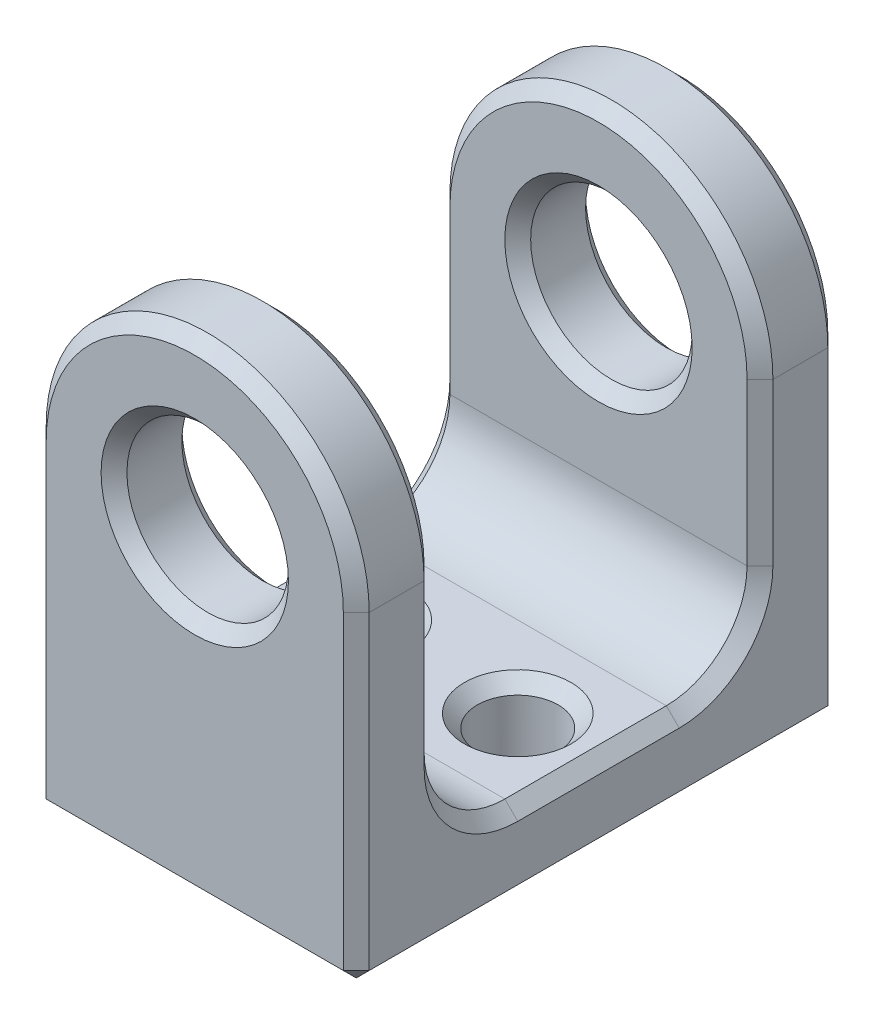
from build123d import *

# Parameters (mm, degrees)
SKETCH1_R                    = 3.175
BOSS_EXTRUDE1_DEPTH          = 9.525
CUT_EXTRUDE1_DEPTH           = 18.097898263
CUT_EXTRUDE1_DEPTH_BACK      = 18.097898263
SKETCH2_W                    = 12.7
SKETCH2_H                    = 15.875
F_1_8_0_125_DIAMETER_HOLE1_D = 3.175
FILLET2_R                    = 3.175
CHAMFER1_SIZE                = 0.508


with BuildPart() as part:
    # Sketch1 → Boss-Extrude1 (new, symmetric)
    with BuildSketch(Plane.XY):
        with BuildLine():
            Line((-6.35, 0), (-6.35, -12.7))
            Line((-6.35, -12.7), (6.35, -12.7))
            Line((6.35, -12.7), (6.35, 0))
            ThreePointArc((6.35, 0), (0, 6.35), (-6.35, 0))
        make_face()
        Circle(SKETCH1_R, mode=Mode.SUBTRACT)
    extrude(amount=BOSS_EXTRUDE1_DEPTH, both=True)

    # Sketch2 → Cut-Extrude1 (cut, two sides: drawn at the far end of the back side and taken through both)
    with BuildSketch(Plane(origin=(0, 0, 0), x_dir=(0, 0, -1), z_dir=(1, 0, 0)).offset(-CUT_EXTRUDE1_DEPTH_BACK)):
        with Locations((0, -1.5875)):
            Rectangle(SKETCH2_W, SKETCH2_H)
    extrude(amount=CUT_EXTRUDE1_DEPTH + CUT_EXTRUDE1_DEPTH_BACK, mode=Mode.SUBTRACT)

    # 1/8 (0.125) Diameter Hole1 (through all)
    with Locations(Plane(origin=(0, -9.525, 0), x_dir=(1, 0, 0), z_dir=(0, 1, 0))):
        with Locations((-3.175, 0), (3.175, 0)):
            Hole(F_1_8_0_125_DIAMETER_HOLE1_D / 2)

    # Fillet2
    fillet2_edges = [part.edges().sort_by_distance(p)[0] for p in [
        (0, -9.525, -6.35),
        (0, -9.525, 6.35),
    ]]
    fillet(fillet2_edges, radius=FILLET2_R)

    # Chamfer1
    chamfer1_edges = [part.edges().sort_by_distance(p)[0] for p in [
        (6.35, -6.35, -9.525),
        (-6.35, -6.35, -9.525),
        (-6.35, -3.175, -6.35),
        (6.35, -3.175, -6.35),
        (-6.35, -9.525, 0),
        (6.35, -9.525, 0),
        (-6.35, -3.175, 6.35),
        (6.35, -3.175, 6.35),
        (6.35, -6.35, 9.525),
        (-6.35, -6.35, 9.525),
        (0, -12.7, -9.525),
        (-6.35, -12.7, 0),
        (0, -12.7, 9.525),
        (6.35, -12.7, 0),
        (-3.175, 0, -9.525),
        (-3.175, 0, -6.35),
        (-3.175, 0, 6.35),
        (-3.175, 0, 9.525),
        (4.7625, -12.7, 0),
        (-1.5875, -12.7, 0),
        (4.7625, -9.525, 0),
        (-1.5875, -9.525, 0),
        (0, 6.35, 6.35),
        (0, 6.35, -6.35),
        (0, 6.35, 9.525),
        (0, 6.35, -9.525),
        (6.35, -8.59506403, 5.42006403),
        (6.35, -8.59506403, -5.42006403),
        (-6.35, -8.59506403, 5.42006403),
        (-6.35, -8.59506403, -5.42006403),
    ]]
    chamfer(chamfer1_edges, length=CHAMFER1_SIZE)


solid = part.part
